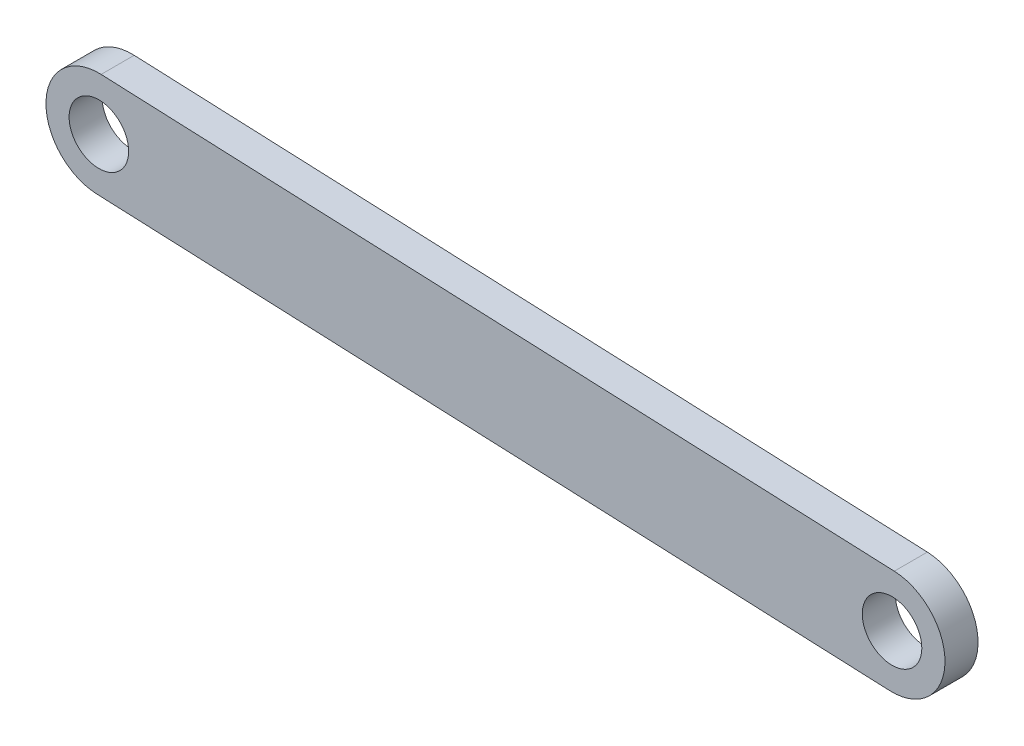
from build123d import *

# Parameters (mm, degrees)
SKETCH_1_R      = 4.5
EXTRUDE_1_DEPTH = 5


with BuildPart() as part:
    # 草图1 → 凸台-拉伸1 (new body)
    with BuildSketch(Plane.XY):
        with BuildLine():
            Line((151.317035713, 41.836054816), (271.209204074, 36.749998809))
            ThreePointArc((271.209204074, 36.749998809), (278.862944897, 28.418117185), (270.531063273, 20.764376361))
            Line((270.531063273, 20.764376361), (150.638894912, 25.850432368))
            ThreePointArc((150.638894912, 25.850432368), (142.985154088, 34.182313992), (151.317035713, 41.836054816))
        make_face()
        with Locations((150.977965312, 33.843243592)):
            Circle(SKETCH_1_R, mode=Mode.SUBTRACT)
        with Locations((270.870133673, 28.757187585)):
            Circle(SKETCH_1_R, mode=Mode.SUBTRACT)
    extrude(amount=EXTRUDE_1_DEPTH)


solid = part.part
